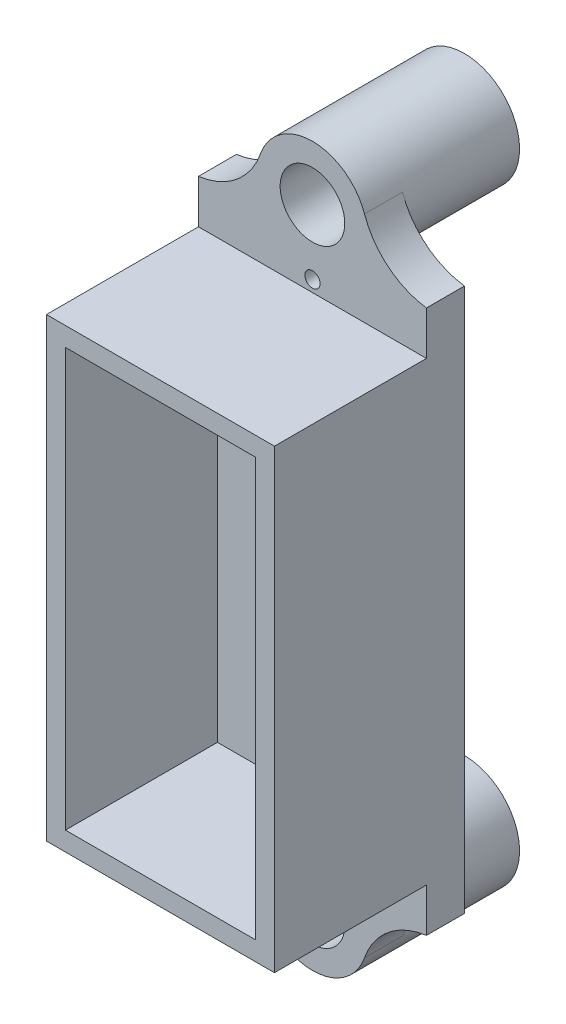
from build123d import *

# Parameters (mm, degrees)
ESBO_O1_R                  = 7.25
ESBO_O1_R_2                = 4.25
RESSALTO_EXTRUS_O1_DEPTH   = 20
RESSALTO_EXTRUS_O1_2_DEPTH = 20
ESBO_O2_W                  = 30
ESBO_O2_H                  = 71.5
RESSALTO_EXTRUS_O2_DEPTH   = 5
FILETE1_R                  = 10
ESBO_O3_W                  = 30
ESBO_O3_H                  = 60
ESBO_O3_W_2                = 25
ESBO_O3_H_2                = 55
RESSALTO_EXTRUS_O3_DEPTH   = 20
ESBO_O4_R                  = 1
CORTE_EXTRUS_O1_DEPTH      = 54.456173638


with BuildPart() as part:
    # Esboço1 → Ressalto-extrusão1 (new body)
    with BuildSketch(Plane.XY):
        with Locations((0, 40)):
            Circle(ESBO_O1_R)
        with Locations((0, 40)):
            Circle(ESBO_O1_R_2, mode=Mode.SUBTRACT)
    extrude(amount=RESSALTO_EXTRUS_O1_DEPTH)



with BuildPart() as body_2:
    # Esboço1 → Ressalto-extrus_o1 2 (new body)
    with BuildSketch(Plane.XY):
        with Locations(Location((0, -40, 0), (0, 0, 180))):
            Circle(ESBO_O1_R)
        with Locations(Location((0, -40, 0), (0, 0, 180))):
            Circle(ESBO_O1_R_2, mode=Mode.SUBTRACT)
    extrude(amount=RESSALTO_EXTRUS_O1_2_DEPTH)


with BuildPart() as part_1:
    add(part.part)

    add(body_2.part)  # Ressalto-extrusão2 merges body 2
    # Esboço2 → Ressalto-extrusão2 (add)
    with BuildSketch(Plane.XY.offset(20)):
        Rectangle(ESBO_O2_W, ESBO_O2_H)
    extrude(amount=-RESSALTO_EXTRUS_O2_DEPTH)

    # Filete1
    # the kernel refuses this fillet: 10 mm, written as the material it adds along each edge
    with BuildSketch(Plane(origin=(-5.873670062, -35.75, 20), x_dir=(-1, 0, 0), z_dir=(0, 0, -1))) as filete1_piece_1:
        with BuildLine():
            CenterArc((10.419216441, -9.916070012), FILETE1_R, 97.428488086, 63.395706738)
            Line((0.974064845, -6.631391744), (0.785161813, -6.565698179))
            ThreePointArc((0.785161813, -6.565698179), (1.101484321, -3.225440913), (-0.162032278, -0.117241379))
            Line((-0.162032278, -0.117241379), (0, 0.2))
            ThreePointArc((0, 0.2), (4.563164969, 0.2), (9.100472208, 0.1983214))
            Line((9.100472208, 0.1983214), (9.126329938, 0))
        make_face()
    extrude(amount=5)
    with BuildSketch(Plane(origin=(5.873670062, -35.75, 20), x_dir=(1, 0, 0), z_dir=(0, 0, -1))) as filete1_piece_2:
        with BuildLine():
            CenterArc((10.419216441, 9.916070012), FILETE1_R, 199.175805176, 63.395706738)
            Line((0.974064845, 6.631391744), (0.785161813, 6.565698179))
            ThreePointArc((0.785161813, 6.565698179), (1.101484321, 3.225440913), (-0.162032278, 0.117241379))
            Line((-0.162032278, 0.117241379), (0, -0.2))
            ThreePointArc((0, -0.2), (4.563164969, -0.2), (9.100472208, -0.1983214))
            Line((9.100472208, -0.1983214), (9.126329938, 0))
        make_face()
    extrude(amount=5)
    with BuildSketch(Plane(origin=(5.873670062, 35.75, 20), x_dir=(0.14532753012910826, 0.9893836005243736, 0), z_dir=(0, 0, -1))) as filete1_piece_3:
        with BuildLine():
            CenterArc((11.324996043, 8.867523914), FILETE1_R, 179.072241898, 63.395706738)
            Line((1.326306989, 9.029441173), (1.126333208, 9.032679519))
            ThreePointArc((1.126333208, 9.032679519), (0.465276774, 4.543786093), (-0.19787672, 0.029065506))
            Line((-0.19787672, 0.029065506), (0.092448947, -0.177350478))
            ThreePointArc((0.092448947, -0.177350478), (3.351274339, 0.621045162), (6.610099731, -0.177350478))
            Line((6.610099731, -0.177350478), (6.702548679, 0))
        make_face()
    extrude(amount=5)
    with BuildSketch(Plane(origin=(-5.873670062, 35.75, 20), x_dir=(-0.14532753012910826, 0.9893836005243736, 0), z_dir=(0, 0, -1))) as filete1_piece_4:
        with BuildLine():
            CenterArc((11.324996043, -8.867523914), FILETE1_R, 117.532051364, 63.395706738)
            Line((1.326306989, -9.029441173), (1.126333208, -9.032679519))
            ThreePointArc((1.126333208, -9.032679519), (0.465276774, -4.543786093), (-0.19787672, -0.029065506))
            Line((-0.19787672, -0.029065506), (0.092448947, 0.177350478))
            ThreePointArc((0.092448947, 0.177350478), (3.351274339, -0.621045162), (6.610099731, 0.177350478))
            Line((6.610099731, 0.177350478), (6.702548679, 0))
        make_face()
    extrude(amount=5)

    # Esboço3 → Ressalto-extrusão3 (add)
    with BuildSketch(Plane.XY.offset(20)):
        Rectangle(ESBO_O3_W, ESBO_O3_H)
        Rectangle(ESBO_O3_W_2, ESBO_O3_H_2, mode=Mode.SUBTRACT)
    extrude(amount=RESSALTO_EXTRUS_O3_DEPTH)

    # Esboço4 → Corte-extrusão1 (cut, through all)
    with BuildSketch(Plane.XY.offset(20)):
        with Locations((0, 31.5)):
            Circle(ESBO_O4_R)
        with Locations(Location((0, -31.5, 0), (0, 0, 180))):
            Circle(ESBO_O4_R)
    extrude(amount=-CORTE_EXTRUS_O1_DEPTH, mode=Mode.SUBTRACT)


solid = part_1.part
